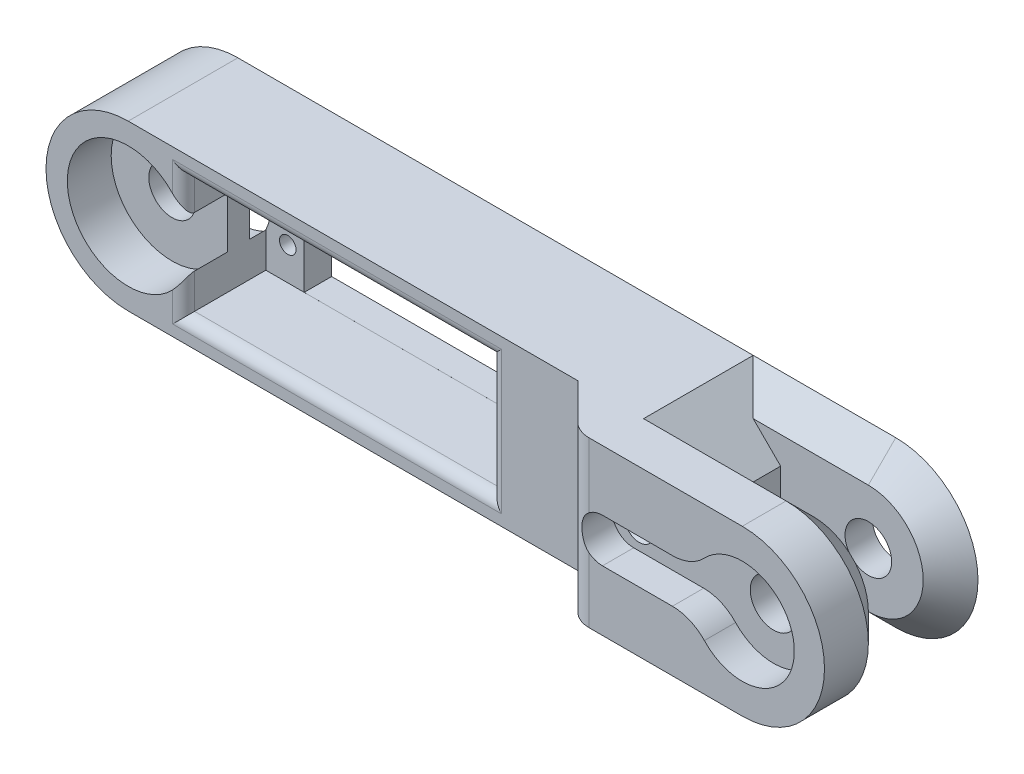
from build123d import *

# Parameters (mm, degrees)
BOSS_EXTRUDE1_DEPTH = 10
SKETCH3_3_R         = 4.25
CUT_EXTRUDE5_DEPTH  = 12
SKETCH3_R           = 4.25
CUT_EXTRUDE6_DEPTH  = 138.295302177
SKETCH4_R           = 4.25
SKETCH4_W           = 42
SKETCH4_H           = 22
CUT_EXTRUDE8_DEPTH  = 138.295302177
SKETCH5_R           = 11.11
CUT_EXTRUDE10_DEPTH = 8
SKETCH7_W           = 56
SKETCH7_H           = 22.002715538
CUT_EXTRUDE12_DEPTH = 15
SKETCH8_R           = 1.5
CUT_EXTRUDE13_DEPTH = 14
SKETCH9_R           = 9.5
CUT_EXTRUDE14_DEPTH = 12
BOSS_EXTRUDE2_START = 8
SKETCH16_R          = 9.5
BOSS_EXTRUDE2_DEPTH = 8
CHAMFER1_SIZE       = 10
FILLET1_R           = 5
FILLET2_R           = 2
BOSS_EXTRUDE3_START = 14.3
SKETCH18_R          = 9.5
SKETCH18_R_2        = 4.25
BOSS_EXTRUDE3_DEPTH = 14.3
CUT_EXTRUDE15_DEPTH = 5.7
SKETCH19_R          = 2.155
CUT_EXTRUDE16_DEPTH = 6
CHAMFER2_SIZE       = 0.5
FILLET3_R           = 8
SKETCH20_W          = 31
SKETCH20_H          = 10
CUT_EXTRUDE17_DEPTH = 140.459671624
CHAMFER4_SIZE       = 5
CHAMFER5_SIZE       = 10


# Some blends are built 0.0001 mm under size
with BuildPart() as part:
    # Sketch1 → Boss-Extrude1 (new, symmetric)
    with BuildSketch(Plane.XY):
        with BuildLine():
            Line((120, 15), (0, 15))
            ThreePointArc((0, 15), (-15, 0), (0, -15))
            Line((0, -15), (120, -15))
            ThreePointArc((120, -15), (135, 0), (120, 15))
        make_face()
    extrude(amount=BOSS_EXTRUDE1_DEPTH, both=True)

    # Sketch3<3> → Cut-Extrude5 (cut)
    with BuildSketch(Plane.XY.offset(10)):
        with BuildLine():
            Line((120, 7.5), (118.514851485, 7.351485149))
            ThreePointArc((118.514851485, 7.351485149), (112.5, 0), (118.514851485, -7.351485149))
            Line((118.514851485, -7.351485149), (120, -7.5))
            ThreePointArc((120, -7.5), (125.303300859, -5.303300859), (127.5, 0))
            ThreePointArc((127.5, 0), (125.303300859, 5.303300859), (120, 7.5))
        make_face()
        with Locations((120, 0)):
            Circle(SKETCH3_3_R, mode=Mode.SUBTRACT)
    extrude(amount=-CUT_EXTRUDE5_DEPTH, mode=Mode.SUBTRACT)

    # Sketch3 → Cut-Extrude6 (cut, through all)
    with BuildSketch(Plane.XY.offset(10)):
        with Locations((120, 0)):
            Circle(SKETCH3_R)
    extrude(amount=-CUT_EXTRUDE6_DEPTH, mode=Mode.SUBTRACT)

    # Sketch4 → Cut-Extrude8 (cut, through all)
    with BuildSketch(Plane.XY.offset(10)):
        Circle(SKETCH4_R)
        with Locations((38.1, 0)):
            Rectangle(SKETCH4_W, SKETCH4_H)
    extrude(amount=-CUT_EXTRUDE8_DEPTH, mode=Mode.SUBTRACT)

    # Sketch5 → Cut-Extrude10 (cut)
    with BuildSketch(Plane(origin=(0, 0, -10), x_dir=(-1, 0, 0), z_dir=(0, 0, -1))):
        Circle(SKETCH5_R)
    cut_extrude10 = extrude(amount=-CUT_EXTRUDE10_DEPTH, mode=Mode.SUBTRACT)

    # Mirror2: Cut-Extrude10 across plane
    add(cut_extrude10.mirror(Plane.XY), mode=Mode.SUBTRACT)

    # Sketch7 → Cut-Extrude12 (cut)
    with BuildSketch(Plane.XY.offset(10)):
        with Locations((38.1, 0)):
            Rectangle(SKETCH7_W, SKETCH7_H)
    extrude(amount=-CUT_EXTRUDE12_DEPTH, mode=Mode.SUBTRACT)

    # Sketch8 → Cut-Extrude13 (cut)
    with BuildSketch(Plane.XY.offset(-5)):
        with Locations((14.1, 5)):
            Circle(SKETCH8_R)
        with Locations((14.1, -5)):
            Circle(SKETCH8_R)
        with Locations((62.1, -5)):
            Circle(SKETCH8_R)
        with Locations((62.1, 5)):
            Circle(SKETCH8_R)
    extrude(amount=-CUT_EXTRUDE13_DEPTH, mode=Mode.SUBTRACT)

    # Sketch9 → Cut-Extrude14 (cut)
    with BuildSketch(Plane.XY.offset(10)):
        with Locations((120, 0)):
            Circle(SKETCH9_R)
    extrude(amount=-CUT_EXTRUDE14_DEPTH, mode=Mode.SUBTRACT)

    # Sketch16 → Boss-Extrude2 (add)
    with BuildSketch(Plane.XY.offset(10).offset(BOSS_EXTRUDE2_START)):
        with BuildLine():
            ThreePointArc((120, -15), (135, 0), (120, 15))
            Line((120, 15), (80, 15))
            Line((80, 15), (80, -15))
            Line((80, -15), (120, -15))
        make_face()
        with Locations((120, 0)):
            Circle(SKETCH16_R, mode=Mode.SUBTRACT)
    extrude(amount=-BOSS_EXTRUDE2_DEPTH)

    # Chamfer1
    # the kernel refuses this chamfer: 10 mm, written as the material it takes off along each edge
    with BuildSketch(Plane(origin=(80, 40.71682988, 18), x_dir=(-0.027495876610586317, 0, -0.9996219169112968), z_dir=(0, -1, 0))) as chamfer1_piece_1_section:
        Polygon((CHAMFER1_SIZE * 0.999621916911, CHAMFER1_SIZE * 0.0274958766106), (-CHAMFER1_SIZE * 0.0274958766106, CHAMFER1_SIZE * 0.999621916911), (0, 0), align=None)
    chamfer1_piece_1 = extrude(amount=81.433659759, mode=Mode.PRIVATE)
    chamfer1_piece_1 = split(chamfer1_piece_1, bisect_by=Plane(origin=(83.457184123, 0, 10), z_dir=(0, 0, 1)), keep=Keep.TOP, mode=Mode.PRIVATE)
    add(chamfer1_piece_1, mode=Mode.SUBTRACT)

    # Fillet1
    fillet1_edges = [part.edges().sort_by_distance(p)[0] for p in [
        (90, 0, 18),
    ]]
    fillet(fillet1_edges, radius=FILLET1_R)

    # Fillet2
    fillet2_edges = [part.edges().sort_by_distance(p)[0] for p in [
        (10.1, -7.81487961, 10),
        (38.1, -11.001357769, 10),
        (66.1, 0, 10),
        (38.1, 11.001357769, 10),
        (10.1, 7.81487961, 10),
    ]]
    fillet(fillet2_edges, radius=FILLET2_R)

    # Sketch18 → Boss-Extrude3 (add)
    with BuildSketch(Plane.XY.offset(-2).offset(BOSS_EXTRUDE3_START)):
        with Locations((120, 0)):
            Circle(SKETCH18_R)
        with Locations((120, 0)):
            Circle(SKETCH18_R_2, mode=Mode.SUBTRACT)
    extrude(amount=-BOSS_EXTRUDE3_DEPTH)

    # Sketch17 → Cut-Extrude15 (cut)
    with BuildSketch(Plane.XY.offset(18)):
        with BuildLine():
            Line((113.07179677, -4), (94.5, -4))
            ThreePointArc((94.5, -4), (90.5, 0), (94.5, 4))
            Line((94.5, 4), (113.07179677, 4))
            ThreePointArc((113.07179677, 4), (128, 0), (113.07179677, -4))
        make_face()
    extrude(amount=-CUT_EXTRUDE15_DEPTH, mode=Mode.SUBTRACT)

    # Sketch19 → Cut-Extrude16 (cut)
    with BuildSketch(Plane.XY.offset(12.3)):
        with Locations((95.5, 0)):
            Circle(SKETCH19_R)
    extrude(amount=-CUT_EXTRUDE16_DEPTH, mode=Mode.SUBTRACT)

    # Chamfer2
    chamfer2_edges = [part.edges().sort_by_distance(p)[0] for p in [
        (93.345, 0, 12.3),
    ]]
    chamfer(chamfer2_edges, length=CHAMFER2_SIZE)

    # Fillet3
    fillet3_edges = [part.edges().sort_by_distance(p)[0] for p in [
        (111.38315603, 4, 15.15),
        (111.38315603, -4, 15.15),
    ]]
    fillet(fillet3_edges, radius=FILLET3_R)

    # Sketch20 → Cut-Extrude17 (cut, through all)
    with BuildSketch(Plane(origin=(0, 15, 0), x_dir=(1, 0, 0), z_dir=(0, 1, 0))):
        with Locations((119.5, 0)):
            Rectangle(SKETCH20_W, SKETCH20_H)
    extrude(amount=-CUT_EXTRUDE17_DEPTH, mode=Mode.SUBTRACT)

    # Chamfer4
    chamfer4_edges = [part.edges().sort_by_distance(p)[0] for p in [
        (112, 15, 5),
        (112, 15, -5),
        (135, 0, 5),
        (112, -15, 5),
        (135, 0, -5),
        (112, -15, -5),
    ]]
    chamfer(chamfer4_edges, length=CHAMFER4_SIZE - 0.0001)  # a hair under: the kernel refuses the full size

    # Chamfer5
    chamfer5_edges = [part.edges().sort_by_distance(p)[0] for p in [
        (104, 15, 0),
        (104, -15, 0),
    ]]
    chamfer(chamfer5_edges, length=CHAMFER5_SIZE)


solid = part.part
